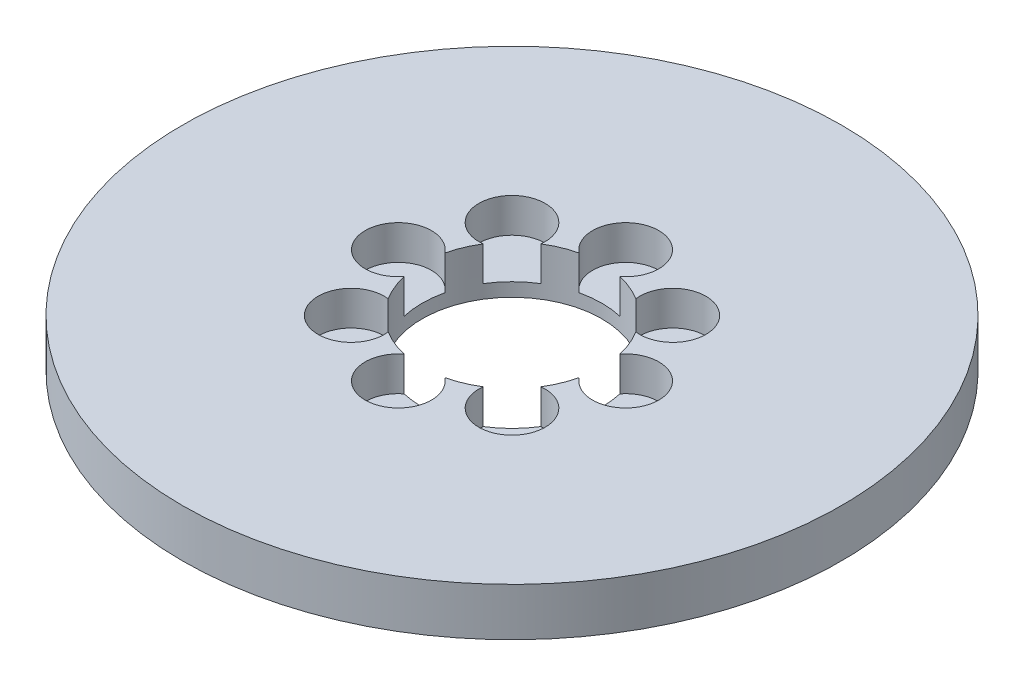
from build123d import *

# Parameters (mm, degrees)
SKETCH1_R           = 27.5
BOSS_EXTRUDE1_DEPTH = 4
SKETCH2_R           = 7.5
CUT_EXTRUDE1_DEPTH  = 40.096035605
SKETCH3_R           = 2.765377474
CUT_EXTRUDE2_DEPTH  = 2.872516315
CIRPATTERN1_COUNT   = 8


with BuildPart() as part:
    # Sketch1 → Boss-Extrude1 (new body)
    with BuildSketch(Plane(origin=(0, 0, 0), x_dir=(1, 0, 0), z_dir=(0, 1, 0))):
        Circle(SKETCH1_R)
    extrude(amount=BOSS_EXTRUDE1_DEPTH)

    # Sketch2 → Cut-Extrude1 (cut, through all)
    with BuildSketch(Plane(origin=(0, 0, 0), x_dir=(1, 0, 0), z_dir=(0, 1, 0))):
        Circle(SKETCH2_R)
    extrude(amount=CUT_EXTRUDE1_DEPTH, mode=Mode.SUBTRACT)

    # Sketch3 → Cut-Extrude2 (cut)
    with BuildSketch(Plane(origin=(0, 4, 0), x_dir=(1, 0, 0), z_dir=(0, 1, 0))):
        with Locations((-9.486828159, 0)):
            Circle(SKETCH3_R)
    cut_extrude2 = extrude(amount=-CUT_EXTRUDE2_DEPTH, mode=Mode.SUBTRACT)

    # CirPattern1: Cut-Extrude2 ×8 about axis
    cirpattern1_axis = Axis((0, 0, 0), (0, 1, 0))
    for i in range(1, CIRPATTERN1_COUNT):
        add(cut_extrude2.rotate(cirpattern1_axis, i * 360 / CIRPATTERN1_COUNT), mode=Mode.SUBTRACT)


solid = part.part
